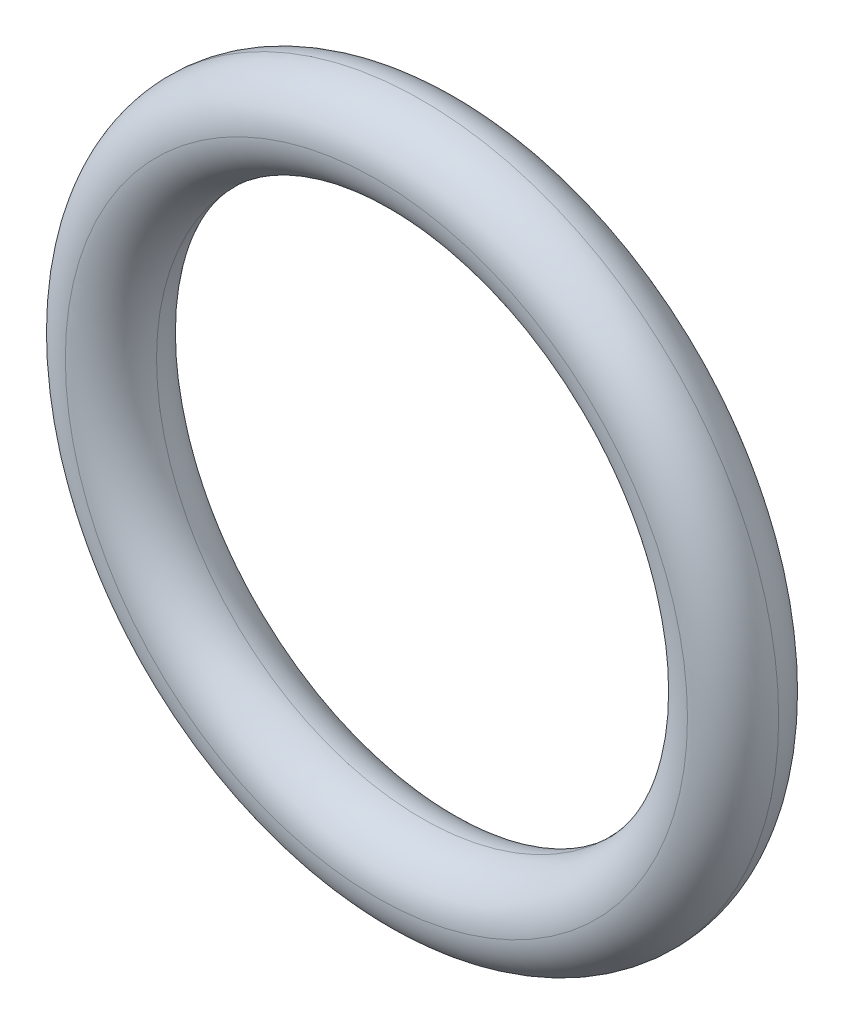
from build123d import *

# Parameters (mm, degrees)
SKETCH2_R           = 9.5377
SKETCH2_R_2         = 7.0993
BOSS_EXTRUDE1_DEPTH = 2.4384
FILLET3_R           = 1.2192


with BuildPart() as part:
    # Sketch2 → Boss-Extrude1 (new body)
    with BuildSketch(Plane.XY):
        Circle(SKETCH2_R)
        Circle(SKETCH2_R_2, mode=Mode.SUBTRACT)
    extrude(amount=-BOSS_EXTRUDE1_DEPTH)

    # Fillet3
    fillet3_edges = [part.edges().sort_by_distance(p)[0] for p in [
        (-9.5377, 0, 0),
        (-9.5377, 0, -2.4384),
        (-7.0993, 0, -2.4384),
        (-7.0993, 0, 0),
    ]]
    fillet(fillet3_edges, radius=FILLET3_R - 0.0001)  # a hair under: the kernel refuses the full size


solid = part.part
